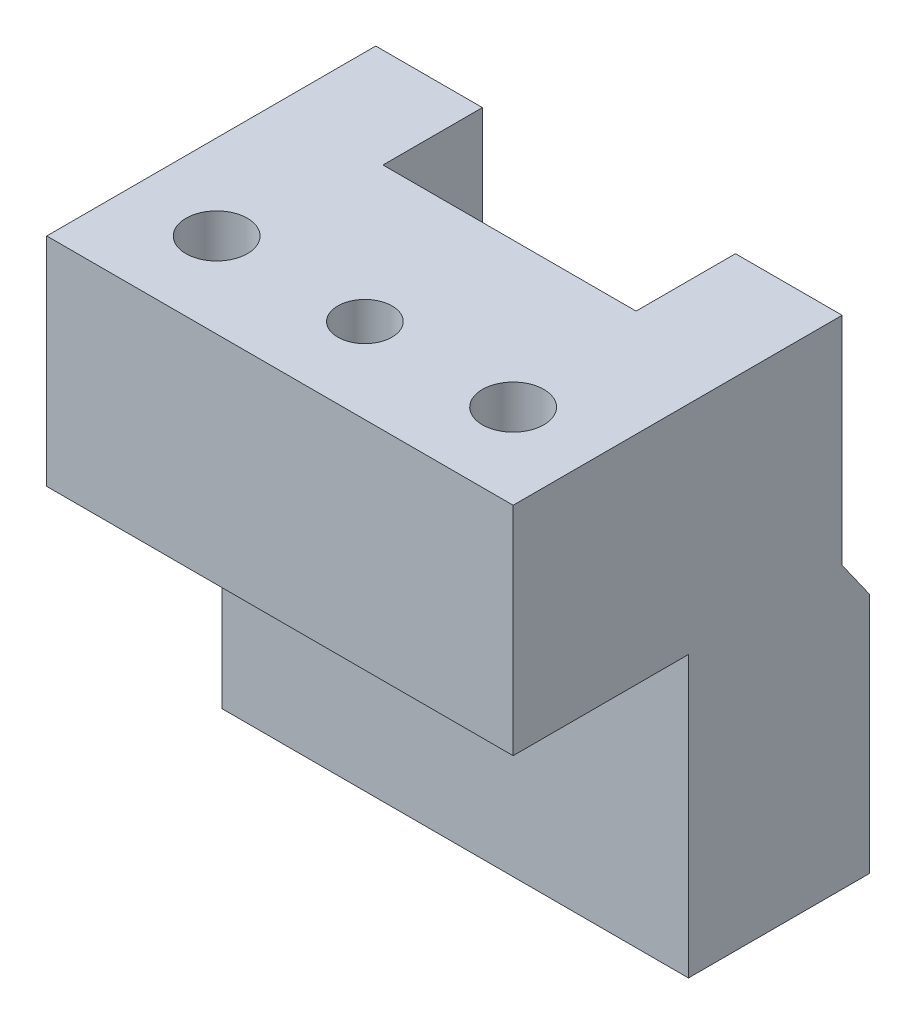
from build123d import *

# Parameters (mm, degrees)
SKETCH1_R           = 1.7
SKETCH1_R_2         = 1.5
BOSS_EXTRUDE1_DEPTH = 12
BOSS_EXTRUDE2_DEPTH = 15.5
SKETCH5_W           = 25.8
SKETCH5_H           = 1.5
BOSS_EXTRUDE3_DEPTH = 3
BOSS_EXTRUDE4_DEPTH = 1.5
CHAMFER1_SIZE       = 1.5


with BuildPart() as part:
    # Sketch1 → Boss-Extrude1 (new body)
    with BuildSketch(Plane(origin=(0, 0, 0), x_dir=(1, 0, 0), z_dir=(0, 1, 0))):
        Polygon((0, 0), (25.8, 0), (25.8, 18.2), (19.9, 18.2), (19.9, 12.7), (5.9, 12.7), (5.9, 18.2), (0, 18.2), align=None)
        with Locations(Location((4.7, 4.7, 0), (0, 0, 270))):
            Circle(SKETCH1_R, mode=Mode.SUBTRACT)
        with Locations(Location((12.9, 4.7, 0), (0, 0, 270))):
            Circle(SKETCH1_R_2, mode=Mode.SUBTRACT)
        with Locations(Location((21.1, 4.7, 0), (0, 0, 270))):
            Circle(SKETCH1_R, mode=Mode.SUBTRACT)
    extrude(amount=BOSS_EXTRUDE1_DEPTH)

    # Sketch4 → Boss-Extrude2 (add)
    with BuildSketch(Plane.XZ):
        Polygon((19.9, -18.2), (19.9, -12.7), (5.9, -12.7), (5.9, -18.2), (0, -18.2), (0, -9.7), (25.8, -9.7), (25.8, -18.2), align=None)
    extrude(amount=BOSS_EXTRUDE2_DEPTH)

    # Sketch5 → Boss-Extrude3 (add)
    with BuildSketch(Plane.XZ.offset(15.5)):
        with Locations((12.9, -18.95)):
            Rectangle(SKETCH5_W, SKETCH5_H)
    extrude(amount=-BOSS_EXTRUDE3_DEPTH)

    # Sketch6 → Boss-Extrude4 (add)
    with BuildSketch(Plane(origin=(0, 0, -19.7), x_dir=(-1, 0, 0), z_dir=(0, 0, -1))):
        Polygon((-25.8, -12.5), (-25.8, -2.1), (-15.4, -12.5), align=None)
        Polygon((0, -12.5), (-10.4, -12.5), (0, -2.1), align=None)
    extrude(amount=-BOSS_EXTRUDE4_DEPTH)

    # Chamfer1
    chamfer1_edges = [part.edges().sort_by_distance(p)[0] for p in [
        (22.85, -5.05, -18.2),
        (2.95, -5.05, -18.2),
    ]]
    chamfer(chamfer1_edges, length=CHAMFER1_SIZE - 0.0001)  # a hair under: the kernel refuses the full size


solid = part.part
